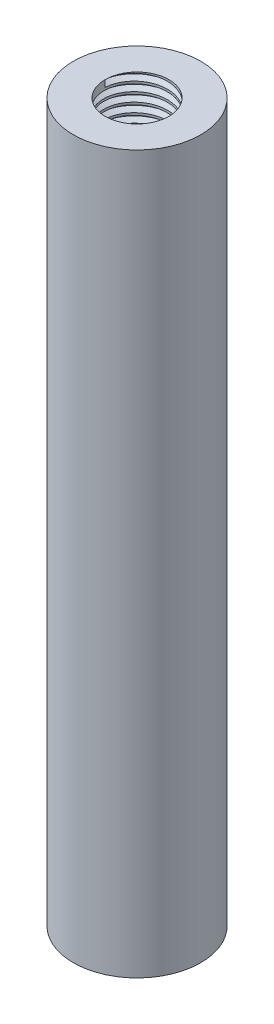
from build123d import *
from build123d.topology import SkipClean

# Parameters (mm, degrees)
SKETCH1_R           = 3.175
BOSS_EXTRUDE1_DEPTH = 35.7251
SKETCH5_R           = 1.5875
CUT_EXTRUDE1_DEPTH  = 6.35
CUT_EXTRUDE2_START  = -6.35
SKETCH4_R           = 1.5875
CUT_EXTRUDE2_DEPTH  = 6.35
THREAD1_PITCH       = 0.79375
THREAD2_PITCH       = 0.453571429


with BuildPart() as part:
    # Sketch1 → Boss-Extrude1 (new body)
    with BuildSketch(Plane(origin=(0, 0, 0), x_dir=(1, 0, 0), z_dir=(0, 1, 0))):
        with Locations(Location((0, 0, 0), (0, 0, 90))):
            Circle(SKETCH1_R)
    extrude(amount=BOSS_EXTRUDE1_DEPTH)

    # Sketch5 → Cut-Extrude1 (cut)
    with BuildSketch(Plane.XZ):
        with Locations(Location((0, 0, 0), (0, 0, 270))):
            Circle(SKETCH5_R)
    extrude(amount=-CUT_EXTRUDE1_DEPTH, mode=Mode.SUBTRACT)

    # Sketch4 → Cut-Extrude2 (cut)
    with BuildSketch(Plane(origin=(0, 35.7251, 0), x_dir=(1, 0, 0), z_dir=(0, 1, 0)).offset(CUT_EXTRUDE2_START)):
        with Locations(Location((0, 0, 0), (0, 0, 90))):
            Circle(SKETCH4_R)
    extrude(amount=CUT_EXTRUDE2_DEPTH, mode=Mode.SUBTRACT)

    # Thread1: the profile of Thread Profile1 profile screwed along a right-hand helix of 8 turns, 8 arcs to a turn; built about Z, then put on its axis
    with SkipClean():  # the faces are left unmerged after this step: merging them gives an invalid solid
        thread1_z = Axis((0, 0, 0), (0, 0, 1))
        thread1_corners = [(1.5872, 0, -0.000173205), (2.017129788, 0, 0.248046874), (2.017129788, 0, 0.347265624), (1.5872, 0, 0.595485703)]
        with BuildLine(mode=Mode.PRIVATE) as thread1_profile:
            Line(thread1_corners[0], thread1_corners[1])
            Line(thread1_corners[1], thread1_corners[2])
            Line(thread1_corners[2], thread1_corners[3])
            Line(thread1_corners[3], thread1_corners[0])
        thread1_cap = Face(thread1_profile.wire())
        thread1_turn_angles = [0, 22.5, 45, 67.5, 90, 112.5, 135, 157.5, 180, 202.5, 225, 247.5, 270, 292.5, 315, 337.5, 360]
        thread1_turn_weights = [1, 0.9238795325112867, 1, 0.9238795325112867, 1, 0.9238795325112867, 1, 0.9238795325112867, 1, 0.9238795325112867, 1, 0.9238795325112867, 1, 0.9238795325112867, 1, 0.9238795325112867, 1]
        thread1_turn_rails = [Edge.make_bspline([Vector(p[0], p[1], 0).rotate(thread1_z, thread1_turn_angles[k]) / thread1_turn_weights[k] + Vector(0, 0, p[2] + THREAD1_PITCH * thread1_turn_angles[k] / 360) for k in range(17)], [0, 0, 0, 1, 1, 2, 2, 3, 3, 4, 4, 5, 5, 6, 6, 7, 7, 8, 8, 8], 2, thread1_turn_weights) for p in thread1_corners]
        thread1_turn_sides = [Face.make_surface_from_curves(thread1_turn_rails[p[0]], thread1_turn_rails[p[1]]) for p in [(0, 1), (1, 2), (2, 3), (3, 0)]]
        thread1 = Plane(origin=(0, 0, 0), x_dir=(1, 0, 0), z_dir=(0, 1, 0)) * Solid(Shell([*[p.moved(Location((0, 0, THREAD1_PITCH * i))) for i in range(8) for p in thread1_turn_sides], thread1_cap, thread1_cap.rotate(thread1_z, 2880).moved(Location((0, 0, THREAD1_PITCH * 2880 / 360)))]))
        add(thread1, mode=Mode.SUBTRACT)

    # Thread2: the profile of Thread Profile2 profile screwed along a right-hand helix of 14 turns, 6 arcs to a turn; built about Z, then put on its axis
    with SkipClean():  # the faces are left unmerged after this step: merging them gives an invalid solid
        thread2_z = Axis((0, 0, 0), (0, 0, 1))
        thread2_corners = [(1.5872, 0, -0.000173205), (1.833002736, 0, 0.141741071), (1.833002736, 0, 0.198437499), (1.5872, 0, 0.340351775)]
        with BuildLine(mode=Mode.PRIVATE) as thread2_profile:
            Line(thread2_corners[0], thread2_corners[1])
            Line(thread2_corners[1], thread2_corners[2])
            Line(thread2_corners[2], thread2_corners[3])
            Line(thread2_corners[3], thread2_corners[0])
        thread2_cap = Face(thread2_profile.wire())
        thread2_turn_angles = [0, 30, 60, 90, 120, 150, 180, 210, 240, 270, 300, 330, 360]
        thread2_turn_weights = [1, 0.8660254037844387, 1, 0.8660254037844387, 1, 0.8660254037844387, 1, 0.8660254037844387, 1, 0.8660254037844387, 1, 0.8660254037844387, 1]
        thread2_turn_rails = [Edge.make_bspline([Vector(p[0], p[1], 0).rotate(thread2_z, thread2_turn_angles[k]) / thread2_turn_weights[k] + Vector(0, 0, p[2] + THREAD2_PITCH * thread2_turn_angles[k] / 360) for k in range(13)], [0, 0, 0, 1, 1, 2, 2, 3, 3, 4, 4, 5, 5, 6, 6, 6], 2, thread2_turn_weights) for p in thread2_corners]
        thread2_turn_sides = [Face.make_surface_from_curves(thread2_turn_rails[p[0]], thread2_turn_rails[p[1]]) for p in [(0, 1), (1, 2), (2, 3), (3, 0)]]
        thread2 = Plane(origin=(0, 35.7251, 0), x_dir=(-1, 0, 0), z_dir=(0, -1, 0)) * Solid(Shell([*[p.moved(Location((0, 0, THREAD2_PITCH * i))) for i in range(14) for p in thread2_turn_sides], thread2_cap, thread2_cap.rotate(thread2_z, 5040).moved(Location((0, 0, THREAD2_PITCH * 5040 / 360)))]))
        add(thread2, mode=Mode.SUBTRACT)


solid = part.part
